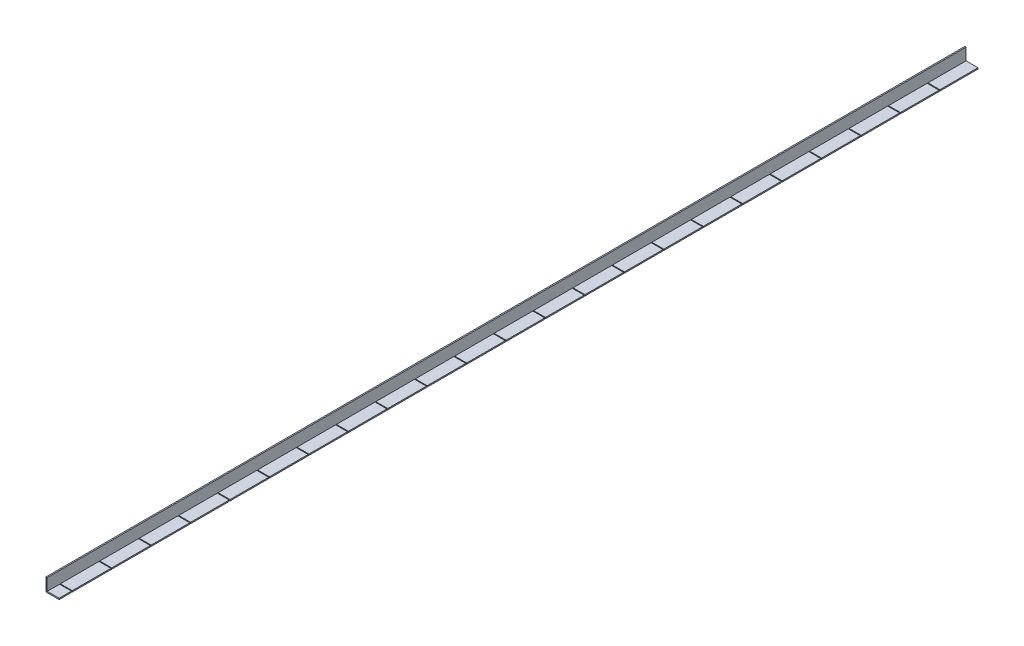
from build123d import *

# Parameters (mm, degrees)
BOSS_EXTRUDE1_DEPTH = 3550.92
SKETCH2_W           = 3.175
SKETCH2_H           = 10.040349426
CUT_EXTRUDE1_DEPTH  = 80
LPATTERN1_COUNT     = 23
LPATTERN1_PITCH     = 152.4


with BuildPart() as part:
    # Sketch1 → Boss-Extrude1 (new body)
    with BuildSketch(Plane.XY):
        Polygon((0, 0), (50.8, 0), (50.8, 4.7625), (4.7625, 4.7625), (4.7625, 50.8), (0, 50.8), align=None)
    extrude(amount=BOSS_EXTRUDE1_DEPTH)

    # Sketch2 → Cut-Extrude1 (cut)
    with BuildSketch(Plane(origin=(4.7625, 0, 0), x_dir=(0, 0, -1), z_dir=(1, 0, 0))):
        with Locations((-148.9075, -0.257674713)):
            Rectangle(SKETCH2_W, SKETCH2_H)
    cut_extrude1 = extrude(amount=CUT_EXTRUDE1_DEPTH, mode=Mode.SUBTRACT)

    # LPattern1: Cut-Extrude1 ×23
    with Locations(*[(0, 0, i * LPATTERN1_PITCH) for i in range(1, LPATTERN1_COUNT)]):
        add(cut_extrude1, mode=Mode.SUBTRACT)


solid = part.part
